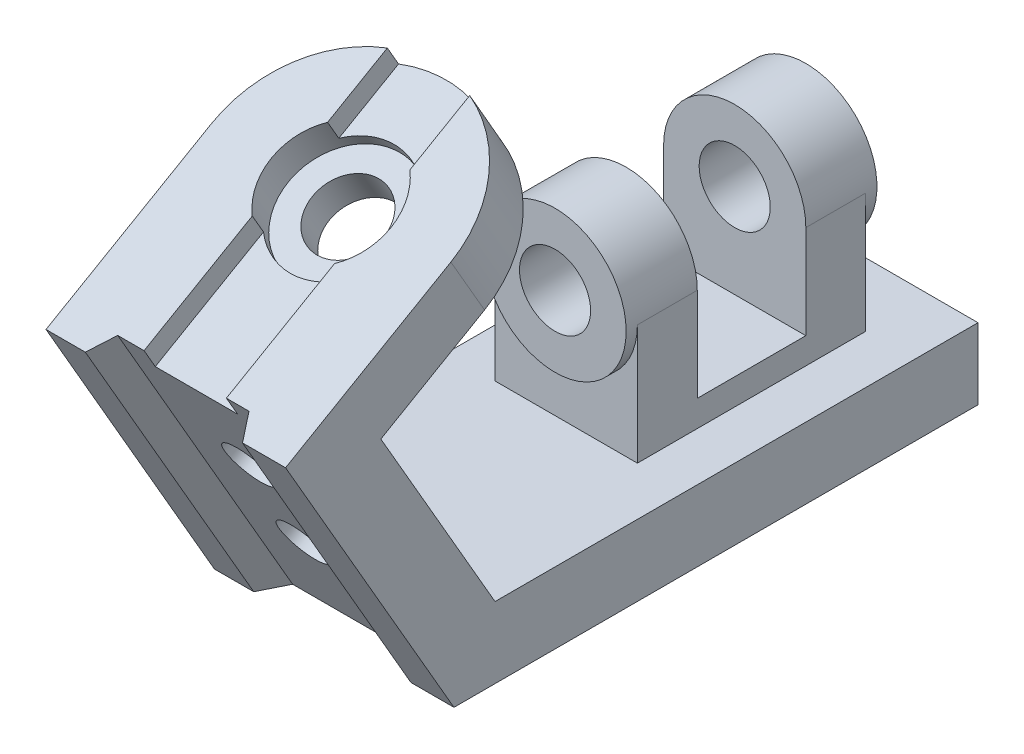
from build123d import *
from build123d.topology import SkipClean

# Parameters (mm, degrees)
BOSS_EXTRUDE1_DEPTH = 32
FILLET3_RADIUS      = 32
FILLET3_LENGTH      = 18
CUT_EXTRUDE2_START  = -6
CUT_EXTRUDE2_DEPTH  = 6
HOLE2_START         = 72
HOLE2_OUTLINE_R     = 9.5
HOLE2_DEPTH         = 12
HOLE2_START_2       = 81
HOLE2_2_OUTLINE_R   = 16
HOLE2_2_OUTLINE_R_2 = 9.5
HOLE2_2_DEPTH       = 9
CUT_EXTRUDE3_DEPTH  = 204.283053893
SKETCH18_R          = 6.5
CUT_EXTRUDE4_DEPTH  = 13
BOSS_EXTRUDE3_DEPTH = 19
FILLET5_RADIUS      = 19
FILLET5_LENGTH      = 16
FILLET6_RADIUS      = 19
FILLET6_LENGTH      = 16
BOSS_EXTRUDE4_START = 3
SKETCH22_R          = 19
BOSS_EXTRUDE4_DEPTH = 3
SKETCH23_R          = 19
BOSS_EXTRUDE5_DEPTH = 3
CUT_EXTRUDE5_REACH  = 162.856
SKETCH24_R          = 9.5


# Read off the part's stored shape, not the designer's step: Hole2
with BuildPart() as part:
    # Sketch2 → Boss-Extrude1 (new, symmetric)
    with BuildSketch(Plane(origin=(0, 0, 0), x_dir=(0, 0, -1), z_dir=(1, 0, 0))):
        Polygon((0, 0), (140, 0), (140, 19), (10.969655115, 19), (-19.545517328, 71.853829072), (35.880108514, 103.853829072), (26.880108514, 119.442286341), (-45, 77.942286341), align=None)
    extrude(amount=BOSS_EXTRUDE1_DEPTH, both=True)

    # Fillet3: full round fillet: the end face becomes a half cylinder, R = half its width
    fillet3_face = Plane((0, 111.648057707, -31.380108514), x_dir=(0, -0.866025403784, -0.5), z_dir=(0, 0.5, -0.866025403784))  # on the end face: x along it, z out of the body
    fillet3_slab = fillet3_face.offset(-FILLET3_RADIUS / 2) * Box(FILLET3_LENGTH, 2 * FILLET3_RADIUS, FILLET3_RADIUS, mode=Mode.PRIVATE)  # the body's end, R deep
    fillet3_round = Plane((0, 95.648057707, -3.667295593), x_dir=(0, 0.5, -0.866025403784), z_dir=(0, -0.866025403784, -0.5)) * Cylinder(FILLET3_RADIUS, FILLET3_LENGTH, mode=Mode.PRIVATE)  # its axis R under the face
    add(fillet3_slab - fillet3_round, mode=Mode.SUBTRACT)

    # Sketch7 → Cut-Extrude2 (cut)
    with BuildSketch(Plane(origin=(0, 77.942286341, 45), x_dir=(1, 0, 0), z_dir=(0, 0.8660254037844397, 0.49999999999999806)).offset(CUT_EXTRUDE2_START)):
        with BuildLine():
            Line((-11, 0), (-11, 81.049958403))
            ThreePointArc((-11, 81.049958403), (0, 83), (11, 81.049958403))
            Line((11, 81.049958403), (11, 0))
            Line((11, 0), (-11, 0))
        make_face()
    extrude(amount=CUT_EXTRUDE2_DEPTH, mode=Mode.SUBTRACT)

    # Hole2 outline → Hole2 (cut)
    with BuildSketch(Plane(origin=(0, 0, 0), x_dir=(1, 0, 0), z_dir=(0, 0.8660254037844399, 0.49999999999999795)).offset(HOLE2_START)):
        with Locations((0, 51)):
            Circle(HOLE2_OUTLINE_R)
    extrude(amount=HOLE2_DEPTH, mode=Mode.SUBTRACT)

    # Hole2 2 outline → Hole2 2 (cut)
    with BuildSketch(Plane(origin=(0, 0, 0), x_dir=(1, 0, 0), z_dir=(0, 0.8660254037844399, 0.49999999999999795)).offset(HOLE2_START_2)):
        with Locations((0, 51)):
            Circle(HOLE2_2_OUTLINE_R)
        with Locations((0, 51)):
            Circle(HOLE2_2_OUTLINE_R_2, mode=Mode.SUBTRACT)
    extrude(amount=HOLE2_2_DEPTH, mode=Mode.SUBTRACT)

    # Sketch17 → Cut-Extrude3 (cut, through all)
    with BuildSketch(Plane(origin=(0, 77.942286341, 45), x_dir=(1, 0, 0), z_dir=(0, 0.8660254037844397, 0.49999999999999806))):
        Polygon((-21.5, 0), (-18.035898385, 6), (17.035898385, 6), (20.5, 0), align=None)
    extrude(amount=-CUT_EXTRUDE3_DEPTH, mode=Mode.SUBTRACT)

    # Sketch18 → Cut-Extrude4 (cut)
    with BuildSketch(Plane(origin=(0, 3, -5.196152423), x_dir=(1, 0, 0), z_dir=(0, -0.49999999999999806, 0.8660254037844398))):
        with Locations(Location((0, 56, 0), (0, 0, 270))):
            Circle(SKETCH18_R)
        with Locations(Location((0, 27, 0), (0, 0, 270))):
            Circle(SKETCH18_R)
    extrude(amount=-CUT_EXTRUDE4_DEPTH, mode=Mode.SUBTRACT)

    # Sketch21 → Boss-Extrude3 (add, symmetric)
    with BuildSketch(Plane(origin=(0, 0, 0), x_dir=(0, 0, -1), z_dir=(1, 0, 0))):
        Polygon((62, 19), (123, 19), (123, 70), (107, 70), (107, 26), (78, 26), (78, 70), (62, 70), align=None)
    extrude(amount=BOSS_EXTRUDE3_DEPTH, both=True)

    # Fillet5: full round fillet: the end face becomes a half cylinder, R = half its width
    fillet5_face = Plane((0, 70, -115), x_dir=(0, 0, 1), z_dir=(0, 1, 0))  # on the end face: x along it, z out of the body
    fillet5_slab = fillet5_face.offset(-FILLET5_RADIUS / 2) * Box(FILLET5_LENGTH, 2 * FILLET5_RADIUS, FILLET5_RADIUS, mode=Mode.PRIVATE)  # the body's end, R deep
    fillet5_round = Plane((0, 51, -115), x_dir=(0, 1, 0), z_dir=(0, 0, 1)) * Cylinder(FILLET5_RADIUS, FILLET5_LENGTH, mode=Mode.PRIVATE)  # its axis R under the face
    add(fillet5_slab - fillet5_round, mode=Mode.SUBTRACT)

    # Fillet6: full round fillet: the end face becomes a half cylinder, R = half its width
    fillet6_face = Plane((0, 70, -70), x_dir=(0, 0, 1), z_dir=(0, 1, 0))  # on the end face: x along it, z out of the body
    fillet6_slab = fillet6_face.offset(-FILLET6_RADIUS / 2) * Box(FILLET6_LENGTH, 2 * FILLET6_RADIUS, FILLET6_RADIUS, mode=Mode.PRIVATE)  # the body's end, R deep
    fillet6_round = Plane((0, 51, -70), x_dir=(0, 1, 0), z_dir=(0, 0, 1)) * Cylinder(FILLET6_RADIUS, FILLET6_LENGTH, mode=Mode.PRIVATE)  # its axis R under the face
    add(fillet6_slab - fillet6_round, mode=Mode.SUBTRACT)

    # Sketch22 → Boss-Extrude4 (add)
    with SkipClean():  # the faces are left unmerged after this step: merging them gives an invalid solid
        with BuildSketch(Plane.XY.offset(-62).offset(BOSS_EXTRUDE4_START)):
            with Locations((0, 51)):
                Circle(SKETCH22_R)
        extrude(amount=-BOSS_EXTRUDE4_DEPTH)

    # Sketch23 → Boss-Extrude5 (add)
    with SkipClean():  # the faces are left unmerged after this step: merging them gives an invalid solid
        with BuildSketch(Plane(origin=(0, 0, -123), x_dir=(-1, 0, 0), z_dir=(0, 0, -1))):
            with Locations(Location((0, 51, 0), (0, 0, 180))):
                Circle(SKETCH23_R)
        extrude(amount=BOSS_EXTRUDE5_DEPTH)

    # Cut-Extrude5: up to this face of the body (flat: up to its plane)
    cut_extrude5_end = Plane(part.part.faces().sort_by_distance((0, 51, -126))[0])
    # Sketch24 → Cut-Extrude5 (cut, up to the picked face)
    with BuildSketch(Plane.XY.offset(-59), mode=Mode.PRIVATE) as cut_extrude5_sk1:
        with Locations(Location((0, 51, 0), (0, 0, 180))):
            Circle(SKETCH24_R)
    cut_extrude5_tool1 = split(extrude(cut_extrude5_sk1.sketch, amount=-CUT_EXTRUDE5_REACH, mode=Mode.PRIVATE), bisect_by=cut_extrude5_end, keep=Keep.BOTH, mode=Mode.PRIVATE)
    add(cut_extrude5_tool1.solids().sort_by(Axis((0, 51, -59), (0, 0, -1)))[0], mode=Mode.SUBTRACT)


solid = part.part
